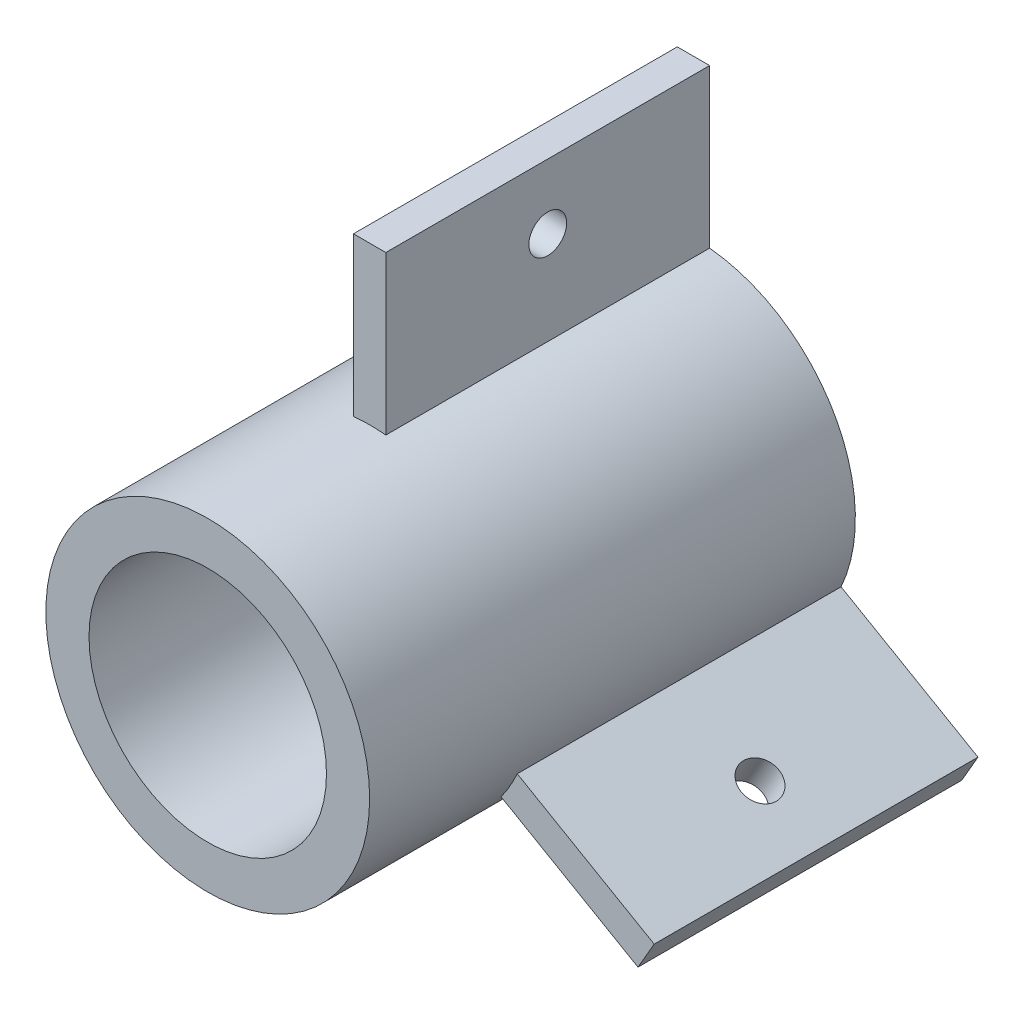
from build123d import *

# Parameters (mm, degrees)
SKETCH_1_R          = 15
EXTRUDE_1_DEPTH     = 45
SKETCH_2_R          = 11
CUT_EXTRUDE_1_DEPTH = 40
SKETCH_3_R          = 7.5
CUT_EXTRUDE_2_DEPTH = 5
SKETCH_4_W          = 3
SKETCH_4_H          = 15
EXTRUDE_2_DEPTH     = 30
SKETCH_5_R          = 1.75
CUT_EXTRUDE_3_DEPTH = 30
SKETCH_6_R          = 1.75
CUT_EXTRUDE_4_DEPTH = 30
SKETCH_7_R          = 1.75
CUT_EXTRUDE_5_DEPTH = 30


with BuildPart() as part:
    # 草圖1 → 填料-伸長1 (new body)
    with BuildSketch(Plane.XY):
        Circle(SKETCH_1_R)
    extrude(amount=EXTRUDE_1_DEPTH)

    # 草圖2 → 除料-伸長1 (cut)
    with BuildSketch(Plane.XY.offset(45)):
        Circle(SKETCH_2_R)
    extrude(amount=-CUT_EXTRUDE_1_DEPTH, mode=Mode.SUBTRACT)

    # 草圖3 → 除料-伸長2 (cut)
    with BuildSketch(Plane.XY.offset(5)):
        Circle(SKETCH_3_R)
    extrude(amount=-CUT_EXTRUDE_2_DEPTH, mode=Mode.SUBTRACT)

    # 草圖4 → 填料-伸長2 (add)
    with BuildSketch(Plane.XY):
        Polygon((26.361016738, -13.487489302), (13.370635681, -5.987489302), (11.870635681, -8.585565513), (24.861016738, -16.085565513), align=None)
        with Locations((0, 22.073054816)):
            Rectangle(SKETCH_4_W, SKETCH_4_H)
        Polygon((-24.861016738, -16.085565513), (-11.870635681, -8.585565513), (-13.370635681, -5.987489302), (-26.361016738, -13.487489302), align=None)
    extrude(amount=EXTRUDE_2_DEPTH)

    # 草圖5 → 除料-伸長3 (cut)
    with BuildSketch(Plane(origin=(-0.75, -1.299038106, 0), x_dir=(0.8660254037844388, -0.49999999999999983, 0), z_dir=(-0.4999999999999998, -0.8660254037844387, 0))):
        with Locations((23.573054816, 15)):
            Circle(SKETCH_5_R)
    extrude(amount=-CUT_EXTRUDE_3_DEPTH, mode=Mode.SUBTRACT)

    # 草圖6 → 除料-伸長4 (cut)
    with BuildSketch(Plane(origin=(1.5, 0, 0), x_dir=(0, 0, -1), z_dir=(1, 0, 0))):
        with Locations((-15, 23.573054816)):
            Circle(SKETCH_6_R)
    extrude(amount=-CUT_EXTRUDE_4_DEPTH, mode=Mode.SUBTRACT)

    # 草圖7 → 除料-伸長5 (cut)
    with BuildSketch(Plane(origin=(-0.75, 1.299038106, 0), x_dir=(0.8660254037844384, 0.5000000000000006, 0), z_dir=(-0.5000000000000006, 0.8660254037844384, 0))):
        with Locations((-23.573054816, -15)):
            Circle(SKETCH_7_R)
    extrude(amount=-CUT_EXTRUDE_5_DEPTH, mode=Mode.SUBTRACT)


solid = part.part
